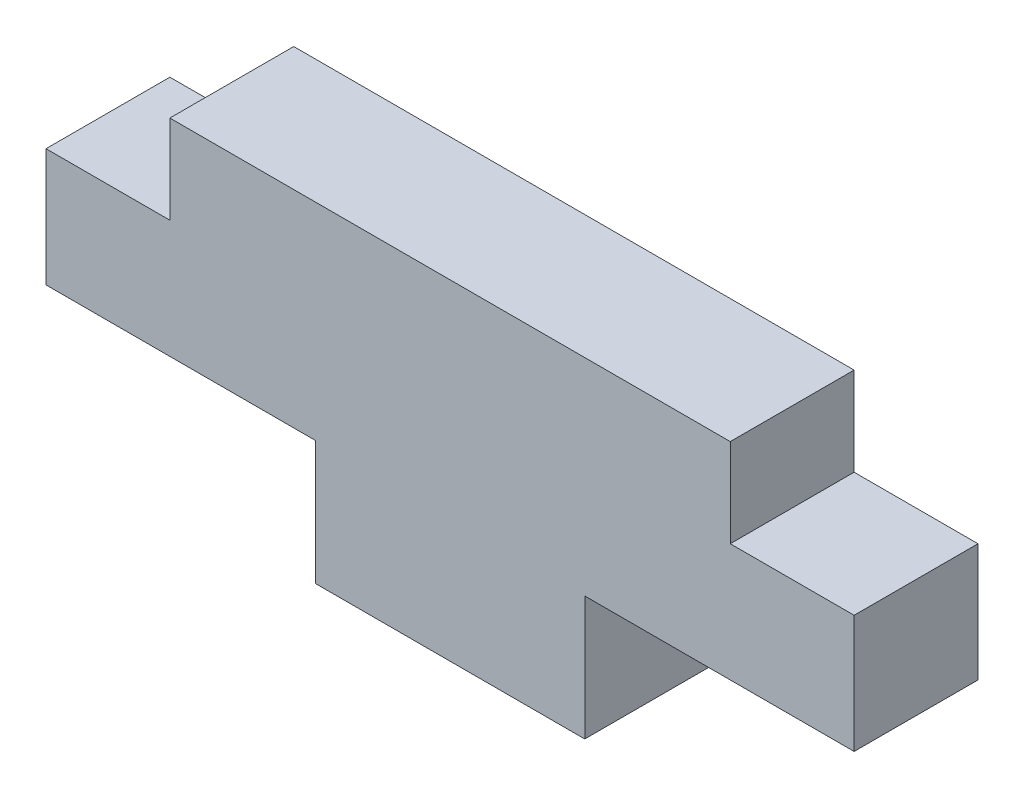
from build123d import *

# Parameters (mm, degrees)
SKETCH1_W            = 24.13
SKETCH1_H            = 8.89
BOSS_EXTRUDE1_DEPTH  = 5.334
SKETCH6_W            = 5.334
SKETCH6_H            = 8.89
BOSS_EXTRUDE5_DEPTH  = 5.334
SKETCH11_W           = 5.334
SKETCH11_H           = 10.206206115
BOSS_EXTRUDE6_DEPTH  = 5.334
SKETCH12_W           = 34.798
SKETCH12_H           = 5.334
BOSS_EXTRUDE7_DEPTH  = 5.334
SKETCH13_W           = 5.334
SKETCH13_H           = 1.316206115
CUT_EXTRUDE1_DEPTH   = 32.634561721
SKETCH17_W           = 11.599333333
SKETCH17_H           = 5.334
CUT_EXTRUDE5_DEPTH   = 5.334
SKETCH18_W           = 5.334
SKETCH18_H           = 3.81
SKETCH18_W_2         = 11.684
CUT_EXTRUDE6_DEPTH   = 5.334
SKETCH19_W           = 5.334
SKETCH19_H           = 3.81
BOSS_EXTRUDE8_DEPTH  = 5.334
SKETCH20_W           = 5.334
SKETCH20_H           = 3.81
BOSS_EXTRUDE10_DEPTH = 1.016


with BuildPart() as part:
    # Sketch1 → Boss-Extrude1 (new body)
    with BuildSketch(Plane.XY):
        with Locations((12.065, 4.445)):
            Rectangle(SKETCH1_W, SKETCH1_H)
    extrude(amount=BOSS_EXTRUDE1_DEPTH)

    # Sketch6 → Boss-Extrude5 (add)
    with BuildSketch(Plane(origin=(24.13, 0, 0), x_dir=(0, 0, -1), z_dir=(1, 0, 0))):
        with Locations((-2.667, 4.445)):
            Rectangle(SKETCH6_W, SKETCH6_H)
    extrude(amount=BOSS_EXTRUDE5_DEPTH)

    # Sketch11 → Boss-Extrude6 (add)
    with BuildSketch(Plane.ZY):
        with Locations((2.667, 5.103103058)):
            Rectangle(SKETCH11_W, SKETCH11_H)
    extrude(amount=BOSS_EXTRUDE6_DEPTH)

    # Sketch12 → Boss-Extrude7 (add)
    with BuildSketch(Plane(origin=(0, 0, 0), x_dir=(-1, 0, 0), z_dir=(0, -1, 0))):
        with Locations((-12.065, -2.667)):
            Rectangle(SKETCH12_W, SKETCH12_H)
    extrude(amount=BOSS_EXTRUDE7_DEPTH)

    # Sketch13 → Cut-Extrude1 (cut, through all)
    with BuildSketch(Plane(origin=(0, 0, 0), x_dir=(-1, 0, 0), z_dir=(0, 0, -1))):
        with Locations((2.667, 9.548103058)):
            Rectangle(SKETCH13_W, SKETCH13_H)
    extrude(amount=-CUT_EXTRUDE1_DEPTH, mode=Mode.SUBTRACT)

    # Sketch17 → Cut-Extrude5 (cut)
    with BuildSketch(Plane(origin=(0, -5.334, 0), x_dir=(-1, 0, 0), z_dir=(0, -1, 0))):
        with Locations((-0.465666666, -2.667)):
            Rectangle(SKETCH17_W, SKETCH17_H)
        with Locations((-23.664333334, -2.667)):
            Rectangle(SKETCH17_W, SKETCH17_H)
    extrude(amount=-CUT_EXTRUDE5_DEPTH, mode=Mode.SUBTRACT)

    # Sketch18 → Cut-Extrude6 (cut)
    with BuildSketch(Plane.XY.offset(5.334)):
        with Locations((-2.667, 6.985)):
            Rectangle(SKETCH18_W, SKETCH18_H)
        with Locations((23.622, 6.985)):
            Rectangle(SKETCH18_W_2, SKETCH18_H)
    extrude(amount=-CUT_EXTRUDE6_DEPTH, mode=Mode.SUBTRACT)

    # Sketch19 → Boss-Extrude8 (add)
    with BuildSketch(Plane(origin=(17.78, 0, 0), x_dir=(0, 0, -1), z_dir=(1, 0, 0))):
        with Locations((-2.667, 6.985)):
            Rectangle(SKETCH19_W, SKETCH19_H)
    extrude(amount=BOSS_EXTRUDE8_DEPTH)

    # Sketch20 → Boss-Extrude10 (add)
    with BuildSketch(Plane(origin=(23.114, 0, 0), x_dir=(0, 0, -1), z_dir=(1, 0, 0))):
        with Locations((-2.667, 6.985)):
            Rectangle(SKETCH20_W, SKETCH20_H)
    extrude(amount=BOSS_EXTRUDE10_DEPTH)


solid = part.part
